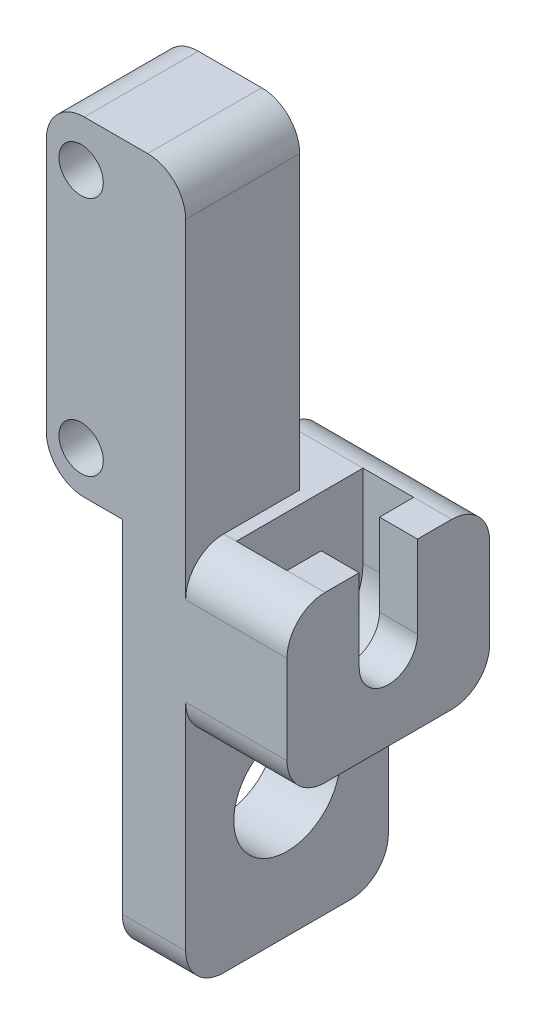
from build123d import *

# Parameters (mm, degrees)
SKETCH1_W           = 16
SKETCH1_H           = 30
SKETCH1_R           = 4.2
BOSS_EXTRUDE1_DEPTH = 5
SKETCH2_W           = 11
SKETCH2_H           = 26
SKETCH2_R           = 1.75
BOSS_EXTRUDE2_DEPTH = 9
SKETCH3_W           = 16
SKETCH3_H           = 13
BOSS_EXTRUDE3_DEPTH = 8
CUT_EXTRUDE1_START  = 1
CUT_EXTRUDE1_DEPTH  = 4
CUT_EXTRUDE2_DEPTH  = 7
FILLET1_START       = -10
FILLET1_DEPTH       = 10
FILLET1_START_2     = 5
FILLET1_2_DEPTH     = 9
FILLET1_START_3     = -6
FILLET1_3_DEPTH     = 11


with BuildPart() as part:
    # Sketch1 → Boss-Extrude1 (new body)
    with BuildSketch(Plane(origin=(0, 0, 0), x_dir=(0, 0, -1), z_dir=(1, 0, 0))):
        with Locations((8, -15)):
            Rectangle(SKETCH1_W, SKETCH1_H)
        with Locations((8, -20)):
            Circle(SKETCH1_R, mode=Mode.SUBTRACT)
    extrude(amount=BOSS_EXTRUDE1_DEPTH)

    # Sketch2 → Boss-Extrude2 (add)
    with BuildSketch(Plane.XY):
        with Locations((-0.5, 13)):
            Rectangle(SKETCH2_W, SKETCH2_H)
        with Locations((-3.25, 22.25)):
            Circle(SKETCH2_R, mode=Mode.SUBTRACT)
        with Locations((-3.25, 3.25)):
            Circle(SKETCH2_R, mode=Mode.SUBTRACT)
    extrude(amount=-BOSS_EXTRUDE2_DEPTH)

    # Sketch3 → Boss-Extrude3 (add)
    with BuildSketch(Plane(origin=(5, 0, 0), x_dir=(0, 0, -1), z_dir=(1, 0, 0))):
        with Locations((8, -6.5)):
            Rectangle(SKETCH3_W, SKETCH3_H)
    extrude(amount=BOSS_EXTRUDE3_DEPTH)

    # Sketch5 → Cut-Extrude1 (cut)
    with BuildSketch(Plane(origin=(5, 0, 0), x_dir=(0, 0, -1), z_dir=(1, 0, 0)).offset(CUT_EXTRUDE1_START)):
        with BuildLine():
            ThreePointArc((3, -6.5), (3.288161187, -8.172894198), (4.119429999, -9.652963125))
            Line((4.119429999, -9.652963125), (11.880570001, -3.347036875))
            ThreePointArc((11.880570001, -3.347036875), (6.327105802, -1.788161187), (3, -6.5))
        make_face()
        with BuildLine():
            Line((11.880570001, -3.347036875), (4.119429999, -9.652963125))
            ThreePointArc((4.119429999, -9.652963125), (9.672894198, -11.211838813), (13, -6.5))
            ThreePointArc((13, -6.5), (12.711838813, -4.827105802), (11.880570001, -3.347036875))
        make_face()
        with BuildLine():
            ThreePointArc((3, -6.5), (6.327105802, -1.788161187), (11.880570001, -3.347036875))
            Line((11.880570001, -3.347036875), (13, -2.4375))
            Line((13, -2.4375), (13, 0))
            Line((13, 0), (9, 0))
            Line((9, 0), (3, 0))
            Line((3, 0), (3, -6.5))
        make_face()
        with BuildLine():
            Line((13, -2.4375), (11.880570001, -3.347036875))
            ThreePointArc((11.880570001, -3.347036875), (12.711838813, -4.827105802), (13, -6.5))
            Line((13, -6.5), (13, -2.4375))
        make_face()
    extrude(amount=CUT_EXTRUDE1_DEPTH, mode=Mode.SUBTRACT)

    # Sketch6 → Cut-Extrude2 (cut)
    with BuildSketch(Plane(origin=(13, 0, 0), x_dir=(0, 0, -1), z_dir=(1, 0, 0))):
        with BuildLine():
            Line((10.3, 0), (5.7, 0))
            Line((5.7, 0), (5.7, -6.5))
            ThreePointArc((5.7, -6.5), (8, -8.8), (10.3, -6.5))
            Line((10.3, -6.5), (10.3, 0))
        make_face()
    extrude(amount=-CUT_EXTRUDE2_DEPTH, mode=Mode.SUBTRACT)

    # Fillet1: read off the stored shape, not the designer's step
    # Fillet1 outline → Fillet1 (cut)
    with BuildSketch(Plane.XY.offset(FILLET1_START)):
        with BuildLine():
            Line((-6, 26), (-6, 23))
            ThreePointArc((-6, 23), (-5.121320344, 25.121320344), (-3, 26))
            Line((-3, 26), (-6, 26))
        make_face()
        with BuildLine():
            ThreePointArc((-3, 0), (-5.121320344, 0.878679656), (-6, 3))
            Line((-6, 3), (-6, 0))
            Line((-6, 0), (-3, 0))
        make_face()
        with BuildLine():
            Line((5, 26), (2, 26))
            ThreePointArc((2, 26), (4.121320344, 25.121320344), (5, 23))
            Line((5, 23), (5, 26))
        make_face()
    extrude(amount=FILLET1_DEPTH, mode=Mode.SUBTRACT)

    # Fillet1 2 outline → Fillet1 2 (cut)
    with BuildSketch(Plane.YZ.offset(FILLET1_START_2)):
        with BuildLine():
            Line((0, 0), (-3, 0))
            ThreePointArc((-3, 0), (-0.878679656, -0.878679656), (0, -3))
            Line((0, -3), (0, 0))
        make_face()
        with BuildLine():
            ThreePointArc((-13, -3), (-12.121320344, -0.878679656), (-10, 0))
            Line((-10, 0), (-13, 0))
            Line((-13, 0), (-13, -3))
        make_face()
        with BuildLine():
            Line((0, -16), (0, -13))
            ThreePointArc((0, -13), (-0.878679656, -15.121320344), (-3, -16))
            Line((-3, -16), (0, -16))
        make_face()
        with BuildLine():
            ThreePointArc((-10, -16), (-12.121320344, -15.121320344), (-13, -13))
            Line((-13, -13), (-13, -16))
            Line((-13, -16), (-10, -16))
        make_face()
    extrude(amount=FILLET1_2_DEPTH, mode=Mode.SUBTRACT)

    # Fillet1 3 outline → Fillet1 3 (cut)
    with BuildSketch(Plane.YZ.offset(FILLET1_START_3)):
        with BuildLine():
            Line((0, -16), (0, -13))
            ThreePointArc((0, -13), (-0.878679656, -15.121320344), (-3, -16))
            Line((-3, -16), (0, -16))
        make_face()
        with BuildLine():
            ThreePointArc((-30, -3), (-29.121320344, -0.878679656), (-27, 0))
            Line((-27, 0), (-30, 0))
            Line((-30, 0), (-30, -3))
        make_face()
        with BuildLine():
            Line((-30, -16), (-27, -16))
            ThreePointArc((-27, -16), (-29.121320344, -15.121320344), (-30, -13))
            Line((-30, -13), (-30, -16))
        make_face()
    extrude(amount=FILLET1_3_DEPTH, mode=Mode.SUBTRACT)


solid = part.part
